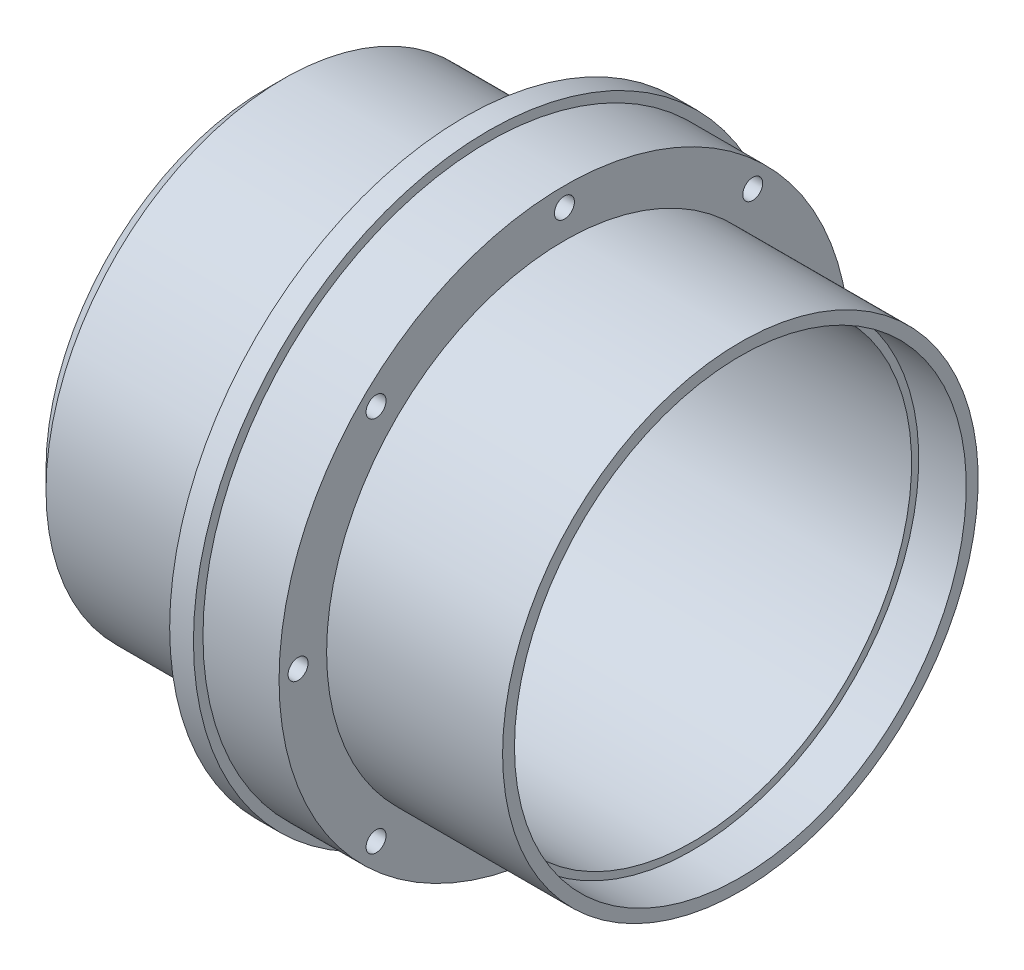
from build123d import *

# Parameters (mm, degrees)
OTW_R_GWINTOWANY_M51_D           = 4.2
OTW_R_GWINTOWANY_M51_CSINK_D     = 5.05
OTW_R_GWINTOWANY_M51_CSINK_ANGLE = 90
OTW_R_GWINTOWANY_M61_D           = 5
OTW_R_GWINTOWANY_M61_CSINK_D     = 6.05
OTW_R_GWINTOWANY_M61_CSINK_ANGLE = 90
OTW_R_GWINTOWANY_M41_D           = 3.3
OTW_R_GWINTOWANY_M41_CSINK_D     = 4.05
OTW_R_GWINTOWANY_M41_CSINK_ANGLE = 90
SZKIC11_R                        = 2.5
WYTNIJ_WYCI_GNI_CIE1_DEPTH       = 133.996240568


with BuildPart() as part:
    # Szkic1 → Obrót1 (revolve)
    with BuildSketch(Plane.XY):
        Polygon((10, 41), (10, 15), (0, 15), (0, 46), (4.000000021, 50.000000021), (40.000000091, 50.000000021), (42.000000091, 51.999999813), (42.000000091, 62.000000021), (47.000000091, 62.000000021), (47.000000091, 60.000000021), (63.000000091, 60.000000021), (63.000000091, 49.999999813), (100, 49.999999813), (100, 47.5), (90, 47.5), (90, 46), (30, 46), (30, 45), (20, 45), (20, 43), (12, 43), align=None)
    revolve(axis=Axis((0, 0, 0), (1, 0, 0)))

    # Otwór gwintowany M51 (through all)
    with Locations(Plane.ZY.offset(-42.000000091)):
        with Locations((0, 56), (39.597979746, 39.597979746), (56, 0), (39.597979746, -39.597979746), (0, -56), (-39.597979746, -39.597979746), (-56, 0), (-39.597979746, 39.597979746)):
            CounterSinkHole(OTW_R_GWINTOWANY_M51_D / 2, OTW_R_GWINTOWANY_M51_CSINK_D / 2, counter_sink_angle=OTW_R_GWINTOWANY_M51_CSINK_ANGLE)

    # Otwór gwintowany M61 (through all)
    with Locations(Plane.ZY):
        with Locations((0, 35), (30.310889132, -17.5), (-30.310889132, -17.5)):
            CounterSinkHole(OTW_R_GWINTOWANY_M61_D / 2, OTW_R_GWINTOWANY_M61_CSINK_D / 2, counter_sink_angle=OTW_R_GWINTOWANY_M61_CSINK_ANGLE)

    # Otwór gwintowany M41 (through all)
    with Locations(Plane.ZY):
        with Locations((0, -40), (-34.641016151, 20), (34.641016151, 20)):
            CounterSinkHole(OTW_R_GWINTOWANY_M41_D / 2, OTW_R_GWINTOWANY_M41_CSINK_D / 2, counter_sink_angle=OTW_R_GWINTOWANY_M41_CSINK_ANGLE)

    # Szkic11 → Wytnij-wyciągnięcie1 (cut, through all)
    with BuildSketch(Plane.ZY):
        with Locations((-21.213203436, 21.213203436)):
            Circle(SZKIC11_R)
        with Locations((21.213203436, 21.213203436)):
            Circle(SZKIC11_R)
        with Locations((21.213203436, -21.213203436)):
            Circle(SZKIC11_R)
        with Locations((-21.213203436, -21.213203436)):
            Circle(SZKIC11_R)
    extrude(amount=-WYTNIJ_WYCI_GNI_CIE1_DEPTH, mode=Mode.SUBTRACT)


solid = part.part
